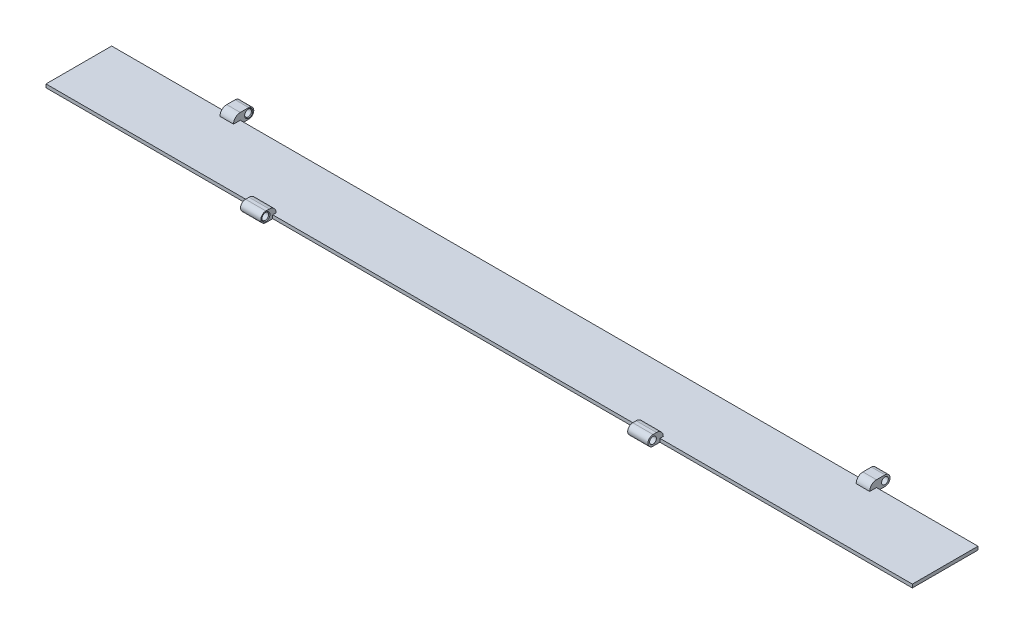
from build123d import *

# Parameters (mm, degrees)
SZKIC1_W                          = 1280
SZKIC1_H                          = 97
DODANIE_WYCI_GNI_CIE1_DEPTH       = 5
DODANIE_WYCI_GNI_CIE2_START       = -5
SZKIC2_W                          = 20
SZKIC2_H                          = 30
DODANIE_WYCI_GNI_CIE2_DEPTH       = 15
ZAOKR_GLENIE2_RADIUS              = 7.5
ZAOKR_GLENIE2_LENGTH              = 20
WYTNIJ_WYCI_GNI_CIE1_REACH        = 1114.213
SZKIC3_R                          = 5
DODANIE_WYCI_GNI_CIE3_START       = -5
SZKIC4_W                          = 30
SZKIC4_H                          = 22.65
DODANIE_WYCI_GNI_CIE3_DEPTH       = 15
ZAOKR_GLENIE3_R                   = 10
ZAOKR_GLENIE4_RADIUS              = 7.5
ZAOKR_GLENIE4_LENGTH              = 30
WYTNIJ_WYCI_GNI_CIE2_REACH        = 979.518
SZKIC5_R                          = 5
SFAZOWANIE1_SIZE                  = 1
ZAOKR_GLENIE5_R                   = 10
ZAOKR_GLENIE4_OF_LUSTRO2_2_RADIUS = 7.5
ZAOKR_GLENIE4_OF_LUSTRO2_2_LENGTH = 30
ZAOKR_GLENIE5_OF_LUSTRO2_R        = 10
ZAOKR_GLENIE2_OF_LUSTRO3_2_RADIUS = 7.5
ZAOKR_GLENIE2_OF_LUSTRO3_2_LENGTH = 20
ZAOKR_GLENIE3_OF_LUSTRO3_R        = 10


with BuildPart() as part:
    # Szkic1 → Dodanie-wyciągnięcie1 (new body)
    with BuildSketch(Plane(origin=(0, 0, 0), x_dir=(1, 0, 0), z_dir=(0, 1, 0))):
        Rectangle(SZKIC1_W, SZKIC1_H)
    extrude(amount=DODANIE_WYCI_GNI_CIE1_DEPTH)

    # Szkic2 → Dodanie-wyciągnięcie2 (add)
    with BuildSketch(Plane(origin=(0, 5, 0), x_dir=(1, 0, 0), z_dir=(0, 1, 0)).offset(DODANIE_WYCI_GNI_CIE2_START)):
        with Locations((-460, 53.5)):
            Rectangle(SZKIC2_W, SZKIC2_H)
    dodanie_wyci_gni_cie2 = extrude(amount=DODANIE_WYCI_GNI_CIE2_DEPTH)

    # Zaokrąglenie2: full round fillet: the end face becomes a half cylinder, R = half its width
    zaokr_glenie2_face = Plane((-460, 7.5, -68.5), x_dir=(-1, 0, 0), z_dir=(0, 0, -1))  # on the end face: x along it, z out of the body
    zaokr_glenie2_slab = zaokr_glenie2_face.offset(-ZAOKR_GLENIE2_RADIUS / 2) * Box(ZAOKR_GLENIE2_LENGTH, 2 * ZAOKR_GLENIE2_RADIUS, ZAOKR_GLENIE2_RADIUS, mode=Mode.PRIVATE)  # the body's end, R deep
    zaokr_glenie2_round = Plane((-460, 7.5, -61), x_dir=(0, 0, -1), z_dir=(-1, 0, 0)) * Cylinder(ZAOKR_GLENIE2_RADIUS, ZAOKR_GLENIE2_LENGTH, mode=Mode.PRIVATE)  # its axis R under the face
    add(zaokr_glenie2_slab - zaokr_glenie2_round, mode=Mode.SUBTRACT)

    # Szkic3 → Wytnij-wyciągnięcie1 (cut, up to next)
    with BuildSketch(Plane.ZY.offset(470), mode=Mode.PRIVATE) as wytnij_wyci_gni_cie1_sk1:
        with Locations((-61, 7.5)):
            Circle(SZKIC3_R)
    wytnij_wyci_gni_cie1_tool1 = extrude(wytnij_wyci_gni_cie1_sk1.sketch, amount=-WYTNIJ_WYCI_GNI_CIE1_REACH, mode=Mode.PRIVATE) & part.part
    wytnij_wyci_gni_cie1 = wytnij_wyci_gni_cie1_tool1.solids().sort_by_distance((-470, 7.5, -61))[0]
    add(wytnij_wyci_gni_cie1, mode=Mode.SUBTRACT)

    # Szkic4 → Dodanie-wyciągnięcie3 (add)
    with BuildSketch(Plane(origin=(0, 5, 0), x_dir=(1, 0, 0), z_dir=(0, 1, 0)).offset(DODANIE_WYCI_GNI_CIE3_START)):
        with Locations((-320, -54.825)):
            Rectangle(SZKIC4_W, SZKIC4_H)
    dodanie_wyci_gni_cie3 = extrude(amount=DODANIE_WYCI_GNI_CIE3_DEPTH)

    # Zaokrąglenie3
    zaokr_glenie3_edges = [part.edges().sort_by_distance(p)[0] for p in [
        (-460, 15, -38.5),
    ]]
    fillet(zaokr_glenie3_edges, radius=ZAOKR_GLENIE3_R - 0.0001)  # a hair under: the kernel refuses the full size

    # Zaokrąglenie4: full round fillet: the end face becomes a half cylinder, R = half its width
    zaokr_glenie4_face = Plane((-320, 7.5, 66.15), x_dir=(1, 0, 0), z_dir=(0, 0, 1))  # on the end face: x along it, z out of the body
    zaokr_glenie4_slab = zaokr_glenie4_face.offset(-ZAOKR_GLENIE4_RADIUS / 2) * Box(ZAOKR_GLENIE4_LENGTH, 2 * ZAOKR_GLENIE4_RADIUS, ZAOKR_GLENIE4_RADIUS, mode=Mode.PRIVATE)  # the body's end, R deep
    zaokr_glenie4_round = Plane((-320, 7.5, 58.65), x_dir=(0, 0, 1), z_dir=(1, 0, 0)) * Cylinder(ZAOKR_GLENIE4_RADIUS, ZAOKR_GLENIE4_LENGTH, mode=Mode.PRIVATE)  # its axis R under the face
    add(zaokr_glenie4_slab - zaokr_glenie4_round, mode=Mode.SUBTRACT)

    # Szkic5 → Wytnij-wyciągnięcie2 (cut, up to next)
    with BuildSketch(Plane.ZY.offset(335), mode=Mode.PRIVATE) as wytnij_wyci_gni_cie2_sk1:
        with Locations((58.65, 7.5)):
            Circle(SZKIC5_R)
    wytnij_wyci_gni_cie2_tool1 = extrude(wytnij_wyci_gni_cie2_sk1.sketch, amount=-WYTNIJ_WYCI_GNI_CIE2_REACH, mode=Mode.PRIVATE) & part.part
    wytnij_wyci_gni_cie2 = wytnij_wyci_gni_cie2_tool1.solids().sort_by_distance((-335, 7.5, 58.65))[0]
    add(wytnij_wyci_gni_cie2, mode=Mode.SUBTRACT)

    # Sfazowanie1
    sfazowanie1_edges = [part.edges().sort_by_distance(p)[0] for p in [
        (-450, 7.5, -66),
        (-470, 7.5, -66),
        (-305, 7.5, 53.65),
        (-335, 7.5, 53.65),
    ]]
    chamfer(sfazowanie1_edges, length=SFAZOWANIE1_SIZE)

    # Zaokrąglenie5
    zaokr_glenie5_edges = [part.edges().sort_by_distance(p)[0] for p in [
        (-320, 15, 43.5),
    ]]
    fillet(zaokr_glenie5_edges, radius=ZAOKR_GLENIE5_R - 0.0001)  # a hair under: the kernel refuses the full size

    # Lustro2: Dodanie-wyciągnięcie3, Wytnij-wyciągnięcie2 across plane
    add(dodanie_wyci_gni_cie3.mirror(Plane(origin=(-34, 0, 0), x_dir=(0, 0, 1), z_dir=(1, 0, 0))))
    add(wytnij_wyci_gni_cie2.mirror(Plane(origin=(-34, 0, 0), x_dir=(0, 0, 1), z_dir=(1, 0, 0))), mode=Mode.SUBTRACT)

    # Zaokrąglenie4 of Lustro2 2: full round fillet: the end face becomes a half cylinder, R = half its width
    zaokr_glenie4_of_lustro2_2_face = Plane((252, 7.5, 66.15), x_dir=(-1, 0, 0), z_dir=(0, 0, 1))  # on the end face: x along it, z out of the body
    zaokr_glenie4_of_lustro2_2_slab = zaokr_glenie4_of_lustro2_2_face.offset(-ZAOKR_GLENIE4_OF_LUSTRO2_2_RADIUS / 2) * Box(ZAOKR_GLENIE4_OF_LUSTRO2_2_LENGTH, 2 * ZAOKR_GLENIE4_OF_LUSTRO2_2_RADIUS, ZAOKR_GLENIE4_OF_LUSTRO2_2_RADIUS, mode=Mode.PRIVATE)  # the body's end, R deep
    zaokr_glenie4_of_lustro2_2_round = Plane((252, 7.5, 58.65), x_dir=(0, 0, 1), z_dir=(-1, 0, 0)) * Cylinder(ZAOKR_GLENIE4_OF_LUSTRO2_2_RADIUS, ZAOKR_GLENIE4_OF_LUSTRO2_2_LENGTH, mode=Mode.PRIVATE)  # its axis R under the face
    add(zaokr_glenie4_of_lustro2_2_slab - zaokr_glenie4_of_lustro2_2_round, mode=Mode.SUBTRACT)

    # Zaokrąglenie5 of Lustro2
    zaokr_glenie5_of_lustro2_edges = [part.edges().sort_by_distance(p)[0] for p in [
        (252, 15, 43.5),
    ]]
    fillet(zaokr_glenie5_of_lustro2_edges, radius=ZAOKR_GLENIE5_OF_LUSTRO2_R - 0.0001)  # a hair under: the kernel refuses the full size

    # Lustro3: Dodanie-wyciągnięcie2, Wytnij-wyciągnięcie1 across plane
    add(dodanie_wyci_gni_cie2.mirror(Plane(origin=(10, 0, 0), x_dir=(0, 0, 1), z_dir=(1, 0, 0))))
    add(wytnij_wyci_gni_cie1.mirror(Plane(origin=(10, 0, 0), x_dir=(0, 0, 1), z_dir=(1, 0, 0))), mode=Mode.SUBTRACT)

    # Zaokrąglenie2 of Lustro3 2: full round fillet: the end face becomes a half cylinder, R = half its width
    zaokr_glenie2_of_lustro3_2_face = Plane((480, 7.5, -68.5), x_dir=(1, 0, 0), z_dir=(0, 0, -1))  # on the end face: x along it, z out of the body
    zaokr_glenie2_of_lustro3_2_slab = zaokr_glenie2_of_lustro3_2_face.offset(-ZAOKR_GLENIE2_OF_LUSTRO3_2_RADIUS / 2) * Box(ZAOKR_GLENIE2_OF_LUSTRO3_2_LENGTH, 2 * ZAOKR_GLENIE2_OF_LUSTRO3_2_RADIUS, ZAOKR_GLENIE2_OF_LUSTRO3_2_RADIUS, mode=Mode.PRIVATE)  # the body's end, R deep
    zaokr_glenie2_of_lustro3_2_round = Plane((480, 7.5, -61), x_dir=(0, 0, -1), z_dir=(1, 0, 0)) * Cylinder(ZAOKR_GLENIE2_OF_LUSTRO3_2_RADIUS, ZAOKR_GLENIE2_OF_LUSTRO3_2_LENGTH, mode=Mode.PRIVATE)  # its axis R under the face
    add(zaokr_glenie2_of_lustro3_2_slab - zaokr_glenie2_of_lustro3_2_round, mode=Mode.SUBTRACT)

    # Zaokrąglenie3 of Lustro3
    zaokr_glenie3_of_lustro3_edges = [part.edges().sort_by_distance(p)[0] for p in [
        (480, 15, -38.5),
    ]]
    fillet(zaokr_glenie3_of_lustro3_edges, radius=ZAOKR_GLENIE3_OF_LUSTRO3_R - 0.0001)  # a hair under: the kernel refuses the full size


solid = part.part
